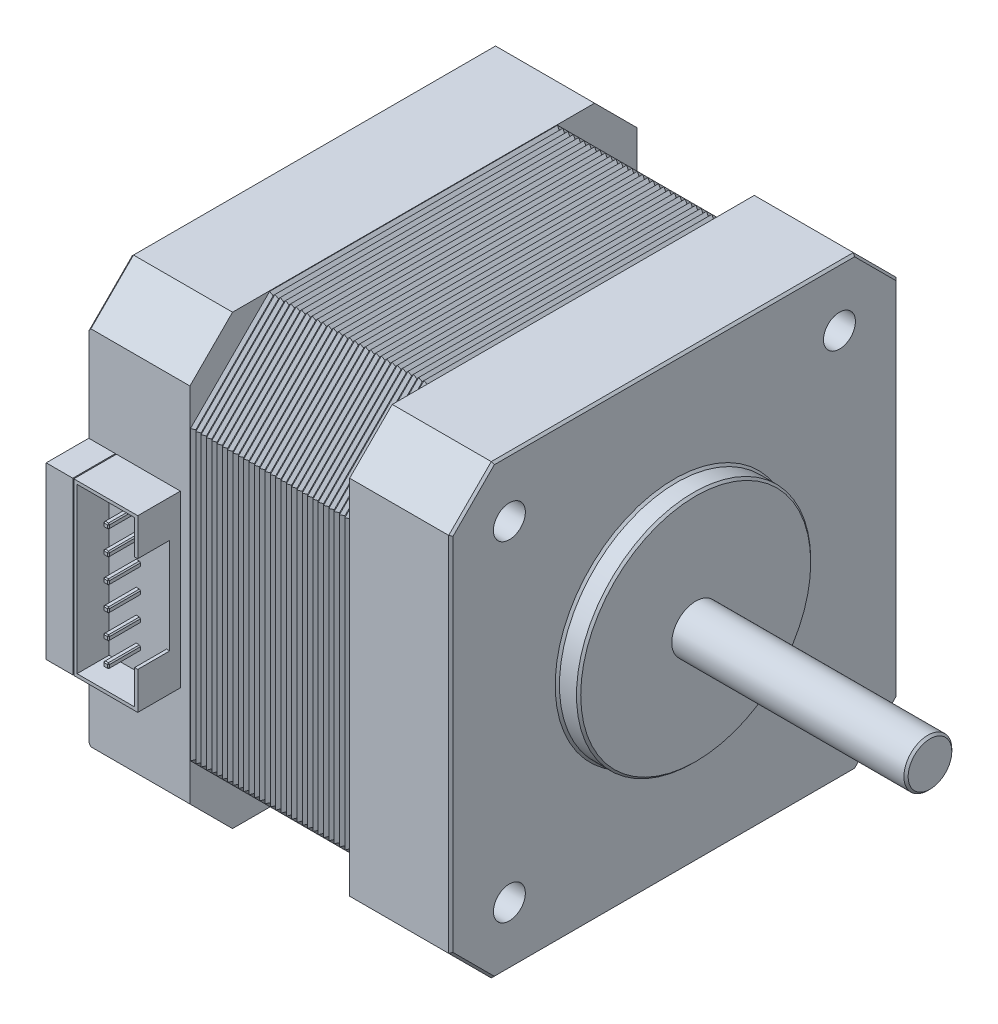
from build123d import *

# Parameters (mm, degrees)
SKETCH1_W            = 42
SKETCH1_H            = 42
BOSS_EXTRUDE1_DEPTH  = 9.5
CHAMFER1_SIZE        = 4
BOSS_EXTRUDE2_DEPTH  = 15
BOSS_EXTRUDE3_DEPTH  = 9.5
SKETCH4_R            = 11
BOSS_EXTRUDE4_DEPTH  = 2
SKETCH5_R            = 2.25
BOSS_EXTRUDE5_DEPTH  = 22
SKETCH6_R            = 1.5
CUT_EXTRUDE1_DEPTH   = 22
SKETCH7_R            = 3
CUT_EXTRUDE2_DEPTH   = 1
SKETCH8_R            = 4.5
CUT_EXTRUDE3_DEPTH   = 3
BOSS_EXTRUDE6_START  = 2
SKETCH9_R            = 2.25
BOSS_EXTRUDE6_DEPTH  = 2
SKETCH10_R           = 3.5
BOSS_EXTRUDE7_DEPTH  = 1
CHAMFER2_SIZE        = 0.2
CUT_EXTRUDE4_REACH   = 76.598
LPATTERN1_COUNT      = 30
LPATTERN1_PITCH      = 0.5
CUT_EXTRUDE6_REACH   = 81.293
LPATTERN3_COUNT      = 30
LPATTERN3_PITCH      = 0.5
CUT_EXTRUDE7_REACH   = 83.019
LPATTERN4_COUNT      = 30
LPATTERN4_PITCH      = 0.5
CUT_EXTRUDE8_REACH   = 76.626
LPATTERN5_COUNT      = 30
LPATTERN5_PITCH      = 0.5
SKETCH16_W           = 2.5
SKETCH16_H           = 16
BOSS_EXTRUDE8_DEPTH  = 4
BOSS_EXTRUDE9_DEPTH  = 4
BOSS_EXTRUDE10_DEPTH = 1
SKETCH19_W           = 0.5
SKETCH19_H           = 0.5
BOSS_EXTRUDE11_DEPTH = 3
CHAMFER3_SIZE        = 0.1


with BuildPart() as part:
    # Sketch1 → Boss-Extrude1 (new body)
    with BuildSketch(Plane(origin=(0, 0, 0), x_dir=(0, 0, -1), z_dir=(1, 0, 0))):
        Rectangle(SKETCH1_W, SKETCH1_H)
    extrude(amount=BOSS_EXTRUDE1_DEPTH)

    # Chamfer1
    chamfer1_edges = [part.edges().sort_by_distance(p)[0] for p in [
        (4.75, -21, -21),
        (4.75, -21, 21),
        (4.75, 21, 21),
        (4.75, 21, -21),
    ]]
    chamfer(chamfer1_edges, length=CHAMFER1_SIZE)

    # Sketch2 → Boss-Extrude2 (add)
    with BuildSketch(Plane(origin=(9.5, 0, 0), x_dir=(0, 0, -1), z_dir=(1, 0, 0))):
        Polygon((-20.95, 13.514466094), (-13.514466094, 20.95), (13.514466094, 20.95), (20.95, 13.514466094), (20.95, -13.514466094), (13.514466094, -20.95), (-13.514466094, -20.95), (-20.95, -13.514466094), align=None)
    extrude(amount=BOSS_EXTRUDE2_DEPTH)

    # Sketch3 → Boss-Extrude3 (add)
    with BuildSketch(Plane(origin=(24.5, 0, 0), x_dir=(0, 0, -1), z_dir=(1, 0, 0))):
        Polygon((-21, 17), (-17, 21), (17, 21), (21, 17), (21, -17), (17, -21), (-17, -21), (-21, -17), align=None)
    extrude(amount=BOSS_EXTRUDE3_DEPTH)

    # Sketch4 → Boss-Extrude4 (add)
    with BuildSketch(Plane(origin=(34, 0, 0), x_dir=(0, 0, -1), z_dir=(1, 0, 0))):
        Circle(SKETCH4_R)
    extrude(amount=BOSS_EXTRUDE4_DEPTH)

    # Sketch5 → Boss-Extrude5 (add)
    with BuildSketch(Plane(origin=(36, 0, 0), x_dir=(0, 0, -1), z_dir=(1, 0, 0))):
        Circle(SKETCH5_R)
    extrude(amount=BOSS_EXTRUDE5_DEPTH)

    # Sketch6 → Cut-Extrude1 (cut)
    with BuildSketch(Plane(origin=(34, 0, 0), x_dir=(0, 0, -1), z_dir=(1, 0, 0))):
        with Locations((-15.5, 15.5)):
            Circle(SKETCH6_R)
        with Locations(Location((15.5, 15.5, 0), (0, 0, 180))):
            Circle(SKETCH6_R)
        with Locations((15.5, -15.5)):
            Circle(SKETCH6_R)
        with Locations(Location((-15.5, -15.5, 0), (0, 0, 180))):
            Circle(SKETCH6_R)
    extrude(amount=-CUT_EXTRUDE1_DEPTH, mode=Mode.SUBTRACT)

    # Sketch7 → Cut-Extrude2 (cut)
    with BuildSketch(Plane.ZY):
        with Locations((-15.5, 15.5)):
            Circle(SKETCH7_R)
        with Locations(Location((15.5, 15.5, 0), (0, 0, 180))):
            Circle(SKETCH7_R)
        with Locations(Location((-15.5, -15.5, 0), (0, 0, 180))):
            Circle(SKETCH7_R)
        with Locations((15.5, -15.5)):
            Circle(SKETCH7_R)
    extrude(amount=-CUT_EXTRUDE2_DEPTH, mode=Mode.SUBTRACT)

    # Sketch8 → Cut-Extrude3 (cut)
    with BuildSketch(Plane.ZY):
        Circle(SKETCH8_R)
    extrude(amount=-CUT_EXTRUDE3_DEPTH, mode=Mode.SUBTRACT)

    # Sketch9 → Boss-Extrude6 (add)
    with BuildSketch(Plane.ZY.offset(-3).offset(BOSS_EXTRUDE6_START)):
        with Locations(Location((0, 0, 0), (0, 0, 180))):
            Circle(SKETCH9_R)
    extrude(amount=-BOSS_EXTRUDE6_DEPTH)

    # Sketch10 → Boss-Extrude7 (add)
    with BuildSketch(Plane.ZY.offset(-3)):
        Circle(SKETCH10_R)
    extrude(amount=BOSS_EXTRUDE7_DEPTH)

    # Chamfer2
    chamfer2_edges = [part.edges().sort_by_distance(p)[0] for p in [
        (0, -21, 0),
        (0, 0, -21),
        (0, 21, 0),
        (0, 19, 19),
        (0, 19, -19),
        (0, -19, -19),
        (0, -19, 19),
        (34, 21, 0),
        (34, 19, 19),
        (34, 0, 21),
        (34, -19, 19),
        (34, -21, 0),
        (34, -19, -19),
        (34, 0, -21),
        (34, 19, -19),
        (34, 0, 11),
        (36, 0, 11),
        (58, 0, 2.25),
    ]]
    chamfer(chamfer2_edges, length=CHAMFER2_SIZE)

    # Cut-Extrude4: up to this face of the body (flat: up to its plane)
    cut_extrude4_end = Plane(part.part.faces().sort_by_distance((17, 0, -20.95))[0])
    # Sketch11 → Cut-Extrude4 (cut, up to the picked face)
    with BuildSketch(Plane.XY.offset(20.95), mode=Mode.PRIVATE) as cut_extrude4_sk1:
        Polygon((9.5, 20.95), (9.738004628, 20.688004628), (10, 20.95), align=None)
    cut_extrude4_tool1 = split(extrude(cut_extrude4_sk1.sketch, amount=-CUT_EXTRUDE4_REACH, mode=Mode.PRIVATE), bisect_by=cut_extrude4_end, keep=Keep.BOTH, mode=Mode.PRIVATE)
    # Sketch11 → Cut-Extrude4 (cut, up to the picked face)
    with BuildSketch(Plane.XY.offset(20.95), mode=Mode.PRIVATE) as cut_extrude4_sk2:
        Polygon((9.738004628, -20.688004628), (10, -20.95), (9.5, -20.95), align=None)
    cut_extrude4_tool2 = split(extrude(cut_extrude4_sk2.sketch, amount=-CUT_EXTRUDE4_REACH, mode=Mode.PRIVATE), bisect_by=cut_extrude4_end, keep=Keep.BOTH, mode=Mode.PRIVATE)
    cut_extrude4_1 = cut_extrude4_tool1.solids().sort_by(Axis((9.746002, 20.862668, 20.95), (0, 0, -1)))[0]
    add(cut_extrude4_1, mode=Mode.SUBTRACT)
    cut_extrude4_2 = cut_extrude4_tool2.solids().sort_by(Axis((9.746002, -20.862668, 20.95), (0, 0, -1)))[0]
    add(cut_extrude4_2, mode=Mode.SUBTRACT)
    cut_extrude4 = cut_extrude4_1 + cut_extrude4_2  # Cut-Extrude4 as one shape, for the pattern or mirror that repeats it

    # LPattern1: Cut-Extrude4 ×30
    with Locations(*[(i * LPATTERN1_PITCH, 0, 0) for i in range(1, LPATTERN1_COUNT)]):
        add(cut_extrude4, mode=Mode.SUBTRACT)

    # Cut-Extrude6: up to this face of the body (flat: up to its plane)
    cut_extrude6_end = Plane(part.part.faces().sort_by_distance((17.000071707, 17.167125751, -17.297340344))[0])
    # Sketch13 → Cut-Extrude6 (cut, up to the picked face)
    with BuildSketch(Plane(origin=(0, -17.232233047, 17.232233047), x_dir=(1, 0, 0), z_dir=(0, -0.7071067811865483, 0.7071067811865468)), mode=Mode.PRIVATE) as cut_extrude6_sk1:
        Polygon((9.5, -24.370057685), (9.75, -24.120057685), (10, -24.370057685), align=None)
    cut_extrude6_tool1 = split(extrude(cut_extrude6_sk1.sketch, amount=-CUT_EXTRUDE6_REACH, mode=Mode.PRIVATE), bisect_by=cut_extrude6_end, keep=Keep.BOTH, mode=Mode.PRIVATE)
    # Sketch13 → Cut-Extrude6 (cut, up to the picked face)
    with BuildSketch(Plane(origin=(0, -17.232233047, 17.232233047), x_dir=(1, 0, 0), z_dir=(0, -0.7071067811865483, 0.7071067811865468)), mode=Mode.PRIVATE) as cut_extrude6_sk2:
        Polygon((9.75, 24.120057685), (10, 24.370057685), (9.5, 24.370057685), align=None)
    cut_extrude6_tool2 = split(extrude(cut_extrude6_sk2.sketch, amount=-CUT_EXTRUDE6_REACH, mode=Mode.PRIVATE), bisect_by=cut_extrude6_end, keep=Keep.BOTH, mode=Mode.PRIVATE)
    cut_extrude6_1 = cut_extrude6_tool1.solids().sort_by(Axis((9.75, -34.405541, 0.058926), (0, 0.7071067811865483, -0.7071067811865468)))[0]
    add(cut_extrude6_1, mode=Mode.SUBTRACT)
    cut_extrude6_2 = cut_extrude6_tool2.solids().sort_by(Axis((9.75, -0.058926, 34.405541), (0, 0.7071067811865483, -0.7071067811865468)))[0]
    add(cut_extrude6_2, mode=Mode.SUBTRACT)
    cut_extrude6 = cut_extrude6_1 + cut_extrude6_2  # Cut-Extrude6 as one shape, for the pattern or mirror that repeats it

    # LPattern3: Cut-Extrude6 ×30
    with Locations(*[(i * LPATTERN3_PITCH, 0, 0) for i in range(1, LPATTERN3_COUNT)]):
        add(cut_extrude6, mode=Mode.SUBTRACT)

    # Cut-Extrude7: up to this face of the body (flat: up to its plane)
    cut_extrude7_end = Plane(part.part.faces().sort_by_distance((4.85, 19, 19))[0])
    # Sketch14 → Cut-Extrude7 (cut, up to the picked face)
    with BuildSketch(Plane(origin=(0, -19, -19), x_dir=(1, 0, 0), z_dir=(0, -0.7071067811865495, -0.7071067811865457)), mode=Mode.PRIVATE) as cut_extrude7_sk1:
        Polygon((24.5, 24.370057685), (24.25, 24.120057685), (24, 24.370057685), align=None)
    cut_extrude7_tool1 = split(extrude(cut_extrude7_sk1.sketch, amount=-CUT_EXTRUDE7_REACH, mode=Mode.PRIVATE), bisect_by=cut_extrude7_end, keep=Keep.BOTH, mode=Mode.PRIVATE)
    # Sketch14 → Cut-Extrude7 (cut, up to the picked face)
    with BuildSketch(Plane(origin=(0, -19, -19), x_dir=(1, 0, 0), z_dir=(0, -0.7071067811865495, -0.7071067811865457)), mode=Mode.PRIVATE) as cut_extrude7_sk2:
        Polygon((24.25, -24.120057685), (24, -24.370057685), (24.5, -24.370057685), align=None)
    cut_extrude7_tool2 = split(extrude(cut_extrude7_sk2.sketch, amount=-CUT_EXTRUDE7_REACH, mode=Mode.PRIVATE), bisect_by=cut_extrude7_end, keep=Keep.BOTH, mode=Mode.PRIVATE)
    cut_extrude7_1 = cut_extrude7_tool1.solids().sort_by(Axis((24.25, -36.173307, -1.826693), (0, 0.7071067811865495, 0.7071067811865457)))[0]
    add(cut_extrude7_1, mode=Mode.SUBTRACT)
    cut_extrude7_2 = cut_extrude7_tool2.solids().sort_by(Axis((24.25, -1.826693, -36.173307), (0, 0.7071067811865495, 0.7071067811865457)))[0]
    add(cut_extrude7_2, mode=Mode.SUBTRACT)
    cut_extrude7 = cut_extrude7_1 + cut_extrude7_2  # Cut-Extrude7 as one shape, for the pattern or mirror that repeats it

    # LPattern4: Cut-Extrude7 ×30
    with Locations(*[(-i * LPATTERN4_PITCH, 0, 0) for i in range(1, LPATTERN4_COUNT)]):
        add(cut_extrude7, mode=Mode.SUBTRACT)

    # Cut-Extrude8: up to this face of the body (flat: up to its plane)
    cut_extrude8_end = Plane(part.part.faces().sort_by_distance((4.85, -21, 0))[0])
    # Sketch15 → Cut-Extrude8 (cut, up to the picked face)
    with BuildSketch(Plane(origin=(0, 21, 0), x_dir=(1, 0, 0), z_dir=(0, 1, 0)), mode=Mode.PRIVATE) as cut_extrude8_sk1:
        Polygon((24.5, 20.95), (24.25, 20.7), (24, 20.95), align=None)
    cut_extrude8_tool1 = split(extrude(cut_extrude8_sk1.sketch, amount=-CUT_EXTRUDE8_REACH, mode=Mode.PRIVATE), bisect_by=cut_extrude8_end, keep=Keep.BOTH, mode=Mode.PRIVATE)
    # Sketch15 → Cut-Extrude8 (cut, up to the picked face)
    with BuildSketch(Plane(origin=(0, 21, 0), x_dir=(1, 0, 0), z_dir=(0, 1, 0)), mode=Mode.PRIVATE) as cut_extrude8_sk2:
        Polygon((24.25, -20.7), (24, -20.95), (24.5, -20.95), align=None)
    cut_extrude8_tool2 = split(extrude(cut_extrude8_sk2.sketch, amount=-CUT_EXTRUDE8_REACH, mode=Mode.PRIVATE), bisect_by=cut_extrude8_end, keep=Keep.BOTH, mode=Mode.PRIVATE)
    cut_extrude8_1 = cut_extrude8_tool1.solids().sort_by(Axis((24.25, 21, -20.866667), (0, -1, 0)))[0]
    add(cut_extrude8_1, mode=Mode.SUBTRACT)
    cut_extrude8_2 = cut_extrude8_tool2.solids().sort_by(Axis((24.25, 21, 20.866667), (0, -1, 0)))[0]
    add(cut_extrude8_2, mode=Mode.SUBTRACT)
    cut_extrude8 = cut_extrude8_1 + cut_extrude8_2  # Cut-Extrude8 as one shape, for the pattern or mirror that repeats it

    # LPattern5: Cut-Extrude8 ×30
    with Locations(*[(-i * LPATTERN5_PITCH, 0, 0) for i in range(1, LPATTERN5_COUNT)]):
        add(cut_extrude8, mode=Mode.SUBTRACT)

    # Sketch16 → Boss-Extrude8 (add)
    with BuildSketch(Plane.XY.offset(21)):
        with Locations((1.25, 0)):
            Rectangle(SKETCH16_W, SKETCH16_H)
    extrude(amount=BOSS_EXTRUDE8_DEPTH)

    # Sketch17 → Boss-Extrude9 (add)
    with BuildSketch(Plane.XY.offset(21)):
        Polygon((2.6, -8), (8.6, -8), (8.6, -4.5), (8.3, -4.5), (8.3, -7.7), (2.9, -7.7), (2.9, 7.7), (8.3, 7.7), (8.3, 4.5), (8.6, 4.5), (8.6, 8), (2.6, 8), align=None)
    extrude(amount=BOSS_EXTRUDE9_DEPTH)

    # Sketch18 → Boss-Extrude10 (add)
    with BuildSketch(Plane.XY.offset(21)):
        Polygon((2.9, -7.7), (2.9, 7.7), (8.3, 7.7), (8.3, 4.5), (8.6, 4.5), (8.6, -4.5), (8.3, -4.5), (8.3, -7.7), align=None)
    extrude(amount=BOSS_EXTRUDE10_DEPTH)

    # Sketch19 → Boss-Extrude11 (add)
    with BuildSketch(Plane.XY.offset(22)):
        with Locations((5.6, 5.68)):
            Rectangle(SKETCH19_W, SKETCH19_H)
        with Locations((5.6, -5.68)):
            Rectangle(SKETCH19_W, SKETCH19_H)
        with Locations((5.6, -3.41)):
            Rectangle(SKETCH19_W, SKETCH19_H)
        with Locations((5.6, -1.14)):
            Rectangle(SKETCH19_W, SKETCH19_H)
        with Locations((5.6, 3.41)):
            Rectangle(SKETCH19_W, SKETCH19_H)
        with Locations((5.6, 1.14)):
            Rectangle(SKETCH19_W, SKETCH19_H)
    extrude(amount=BOSS_EXTRUDE11_DEPTH)

    # Chamfer3
    chamfer3_edges = [part.edges().sort_by_distance(p)[0] for p in [
        (5.6, -5.43, 25),
        (5.85, -5.43, 23.5),
        (5.85, -5.68, 25),
        (5.85, -5.93, 23.5),
        (5.6, -5.93, 25),
        (5.35, -5.93, 23.5),
        (5.35, -5.68, 25),
        (5.35, -5.43, 23.5),
        (5.6, -3.16, 25),
        (5.85, -3.16, 23.5),
        (5.85, -3.41, 25),
        (5.85, -3.66, 23.5),
        (5.6, -3.66, 25),
        (5.35, -3.66, 23.5),
        (5.35, -3.41, 25),
        (5.35, -3.16, 23.5),
        (5.6, -0.89, 25),
        (5.85, -0.89, 23.5),
        (5.85, -1.14, 25),
        (5.85, -1.39, 23.5),
        (5.6, -1.39, 25),
        (5.35, -1.39, 23.5),
        (5.35, -1.14, 25),
        (5.35, -0.89, 23.5),
        (5.6, 5.43, 25),
        (5.35, 5.43, 23.5),
        (5.35, 5.68, 25),
        (5.35, 5.93, 23.5),
        (5.6, 5.93, 25),
        (5.85, 5.93, 23.5),
        (5.85, 5.68, 25),
        (5.85, 5.43, 23.5),
        (5.85, 3.41, 25),
        (5.85, 3.16, 23.5),
        (5.6, 3.16, 25),
        (5.35, 3.16, 23.5),
        (5.35, 3.41, 25),
        (5.35, 3.66, 23.5),
        (5.6, 3.66, 25),
        (5.85, 3.66, 23.5),
        (5.85, 1.14, 25),
        (5.85, 0.89, 23.5),
        (5.6, 0.89, 25),
        (5.35, 0.89, 23.5),
        (5.35, 1.14, 25),
        (5.35, 1.39, 23.5),
        (5.6, 1.39, 25),
        (5.85, 1.39, 23.5),
    ]]
    chamfer(chamfer3_edges, length=CHAMFER3_SIZE)


solid = part.part
